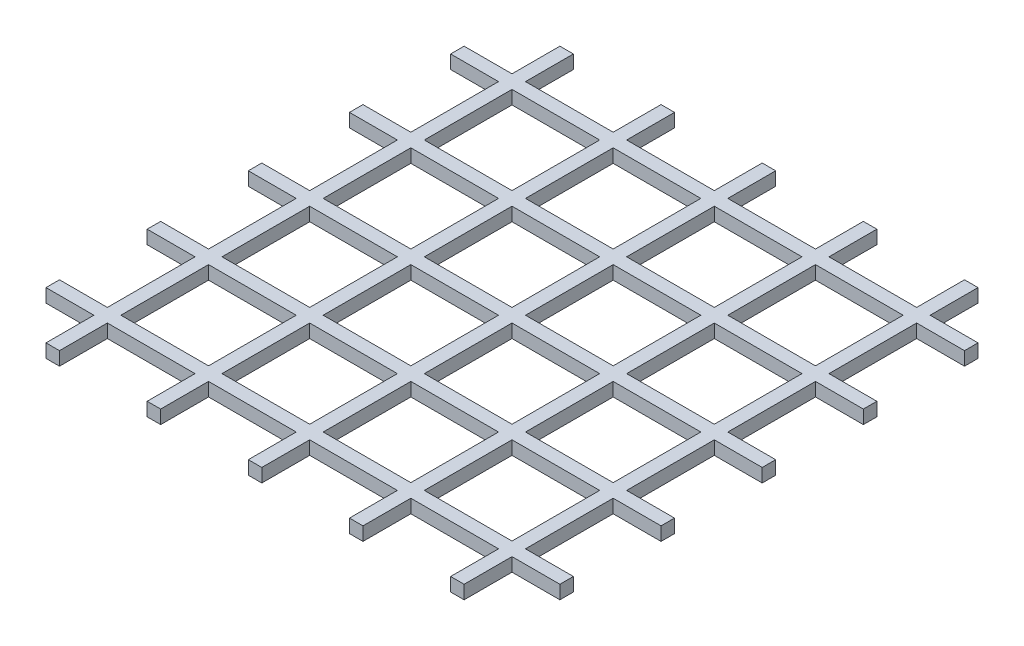
from build123d import *

# Parameters (mm, degrees)
SKETCH1_W             = 2
SKETCH1_H             = 76.2
BOSS_EXTRUDE1_DEPTH   = 2
BOSS_EXTRUDE1_2_DEPTH = 2
BOSS_EXTRUDE1_3_DEPTH = 2
BOSS_EXTRUDE1_4_DEPTH = 2
BOSS_EXTRUDE1_5_DEPTH = 2
SKETCH2_W             = 76.2
SKETCH2_H             = 2
BOSS_EXTRUDE2_DEPTH   = 2


with BuildPart() as part:
    # Sketch1 → Boss-Extrude1 (new body)
    with BuildSketch(Plane(origin=(0, 0, 0), x_dir=(1, 0, 0), z_dir=(0, 1, 0))):
        with Locations((2.133333333, -13.766666667)):
            Rectangle(SKETCH1_W, SKETCH1_H)
    extrude(amount=BOSS_EXTRUDE1_DEPTH)



with BuildPart() as body_2:
    # Sketch1 → Boss-Extrude1 2 (new body)
    with BuildSketch(Plane(origin=(0, 0, 0), x_dir=(1, 0, 0), z_dir=(0, 1, 0))):
        with Locations((-12.866666667, -13.766666667)):
            Rectangle(SKETCH1_W, SKETCH1_H)
    extrude(amount=BOSS_EXTRUDE1_2_DEPTH)


with BuildPart() as body_3:
    # Sketch1 → Boss-Extrude1 3 (new body)
    with BuildSketch(Plane(origin=(0, 0, 0), x_dir=(1, 0, 0), z_dir=(0, 1, 0))):
        with Locations((17.133333333, -13.766666667)):
            Rectangle(SKETCH1_W, SKETCH1_H)
    extrude(amount=BOSS_EXTRUDE1_3_DEPTH)


with BuildPart() as body_4:
    # Sketch1 → Boss-Extrude1 4 (new body)
    with BuildSketch(Plane(origin=(0, 0, 0), x_dir=(1, 0, 0), z_dir=(0, 1, 0))):
        with Locations((32.133333333, -13.766666667)):
            Rectangle(SKETCH1_W, SKETCH1_H)
    extrude(amount=BOSS_EXTRUDE1_4_DEPTH)


with BuildPart() as body_5:
    # Sketch1 → Boss-Extrude1 5 (new body)
    with BuildSketch(Plane(origin=(0, 0, 0), x_dir=(1, 0, 0), z_dir=(0, 1, 0))):
        with Locations((47.133333333, -13.766666667)):
            Rectangle(SKETCH1_W, SKETCH1_H)
    extrude(amount=BOSS_EXTRUDE1_5_DEPTH)


with BuildPart() as part_1:
    add(part.part)

    add(body_2.part)  # Boss-Extrude2 merges body 2

    add(body_3.part)  # Boss-Extrude2 merges body 3

    add(body_4.part)  # Boss-Extrude2 merges body 4

    add(body_5.part)  # Boss-Extrude2 merges body 5
    # Sketch2 → Boss-Extrude2 (add)
    with BuildSketch(Plane(origin=(0, 0, 0), x_dir=(1, 0, 0), z_dir=(0, 1, 0))):
        with Locations((17.133333333, 1.233333333)):
            Rectangle(SKETCH2_W, SKETCH2_H)
        with Locations((17.133333333, 16.233333333)):
            Rectangle(SKETCH2_W, SKETCH2_H)
        with Locations((17.133333333, -13.766666667)):
            Rectangle(SKETCH2_W, SKETCH2_H)
        with Locations((17.133333333, -28.766666667)):
            Rectangle(SKETCH2_W, SKETCH2_H)
        with Locations((17.133333333, -43.766666667)):
            Rectangle(SKETCH2_W, SKETCH2_H)
    extrude(amount=BOSS_EXTRUDE2_DEPTH)


solid = part_1.part
